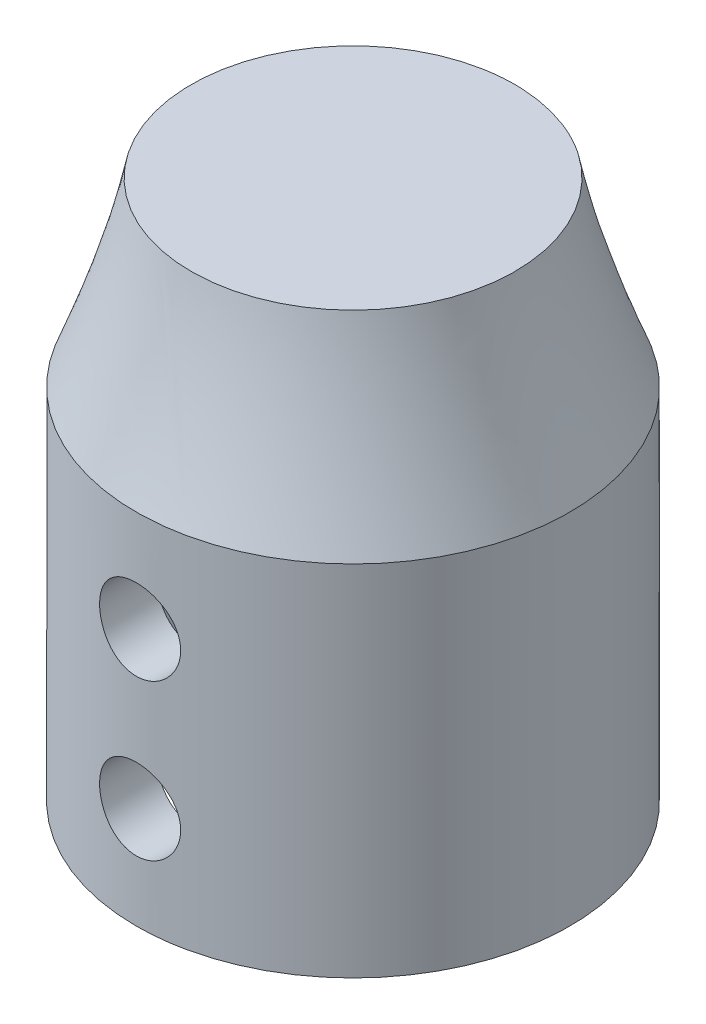
from build123d import *

# Parameters (mm, degrees)
SKETCH1_R           = 8.5
BOSS_EXTRUDE1_DEPTH = 14.06
SKETCH4_R           = 6.355
CUT_EXTRUDE5_DEPTH  = 17.81
SKETCH5_R           = 1.59
CUT_EXTRUDE6_DEPTH  = 10


with BuildPart() as part:
    # Sketch1 → Boss-Extrude1 (new body)
    with BuildSketch(Plane(origin=(0, 0, 0), x_dir=(1, 0, 0), z_dir=(0, 1, 0))):
        with Locations(Location((0, 0, 0), (0, 0, 270))):
            Circle(SKETCH1_R)
    extrude(amount=BOSS_EXTRUDE1_DEPTH)

    # Loft1: read off the stored shape, not the designer's step
    # Loft1: loft between two sections, ruled curve by curve
    loft1_from = [
        Edge.make_bspline([(-1.303322944, 21.16, 6.214808871), (-13.732940686, 21.16, 3.608162984), (-11.126294799, 21.16, -8.821454758), (1.303322944, 21.16, -6.214808871), (13.732940686, 21.16, -3.608162984), (11.126294799, 21.16, 8.821454758), (-1.303322944, 21.16, 6.214808871)], [0, 0, 0, 0, 0.5, 0.5, 0.5, 1, 1, 1, 1], 3, [1, 0.333333333, 0.333333333, 1, 0.333333333, 0.333333333, 1]),
    ]
    loft1_to = [
        Edge.make_bspline([(1.802060434, 14.06, 8.30677905), (-14.811497666, 14.06, 11.910899919), (-18.415618535, 14.06, -4.702658182), (-1.802060434, 14.06, -8.30677905), (14.811497666, 14.06, -11.910899919), (18.415618535, 14.06, 4.702658182), (1.802060434, 14.06, 8.30677905)], [0, 0, 0, 0, 0.5, 0.5, 0.5, 1, 1, 1, 1], 3, [1, 0.333333333, 0.333333333, 1, 0.333333333, 0.333333333, 1]),
    ]
    loft1 = Solid(Shell([*[Face.make_surface_from_curves(loft1_from[k], loft1_to[k]) for k in range(1)], Face(Wire(loft1_from)), Face(Wire(loft1_to))]))
    add(loft1)

    # Sketch4 → Cut-Extrude5 (cut)
    with BuildSketch(Plane.XZ):
        with Locations(Location((0, 0, 0), (0, 0, 270))):
            Circle(SKETCH4_R)
    extrude(amount=-CUT_EXTRUDE5_DEPTH, mode=Mode.SUBTRACT)

    # Sketch5 → Cut-Extrude6 (cut, symmetric)
    with BuildSketch(Plane.XY):
        with Locations((0, 10.076564013)):
            Circle(SKETCH5_R)
        with Locations((0, 3.977190907)):
            Circle(SKETCH5_R)
    extrude(amount=CUT_EXTRUDE6_DEPTH, both=True, mode=Mode.SUBTRACT)


solid = part.part
